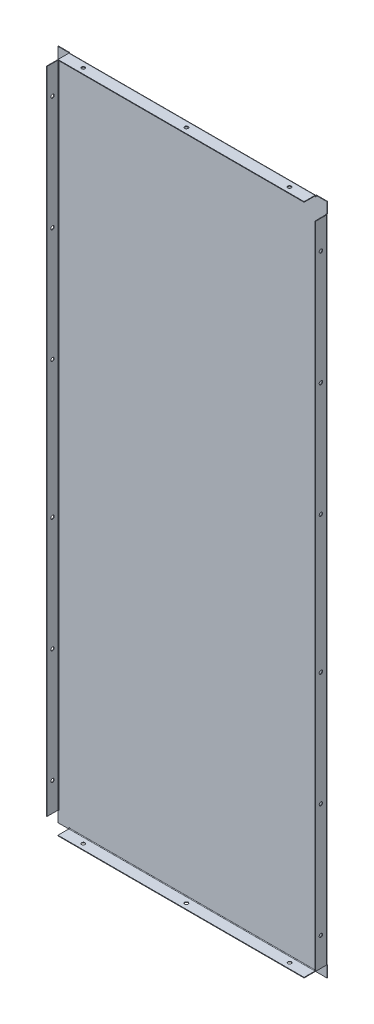
from build123d import *

# Parameters (mm, degrees)
SKETCH1_W                     = 472
SKETCH1_H                     = 1
BASE_FLANGE1_DEPTH            = 590
EDGE_FLANGE1_STRIP_W          = 6
EDGE_FLANGE1_STRIP_H          = 1
EDGE_FLANGE1_STRIP_CUT_DEPTH  = 432
EDGE_FLANGE1_RELIEF_W         = 6.5
EDGE_FLANGE1_RELIEF_H         = 0.5
EDGE_FLANGE1_RELIEF_CUT_DEPTH = 1
EDGE_FLANGE1_DEPTH            = 432
EDGE_FLANGE2_STRIP_W          = 6
EDGE_FLANGE2_STRIP_H          = 1
EDGE_FLANGE2_STRIP_CUT_DEPTH  = 1140
EDGE_FLANGE2_RELIEF_W         = 6.5
EDGE_FLANGE2_RELIEF_H         = 0.5
EDGE_FLANGE2_RELIEF_CUT_DEPTH = 1
EDGE_FLANGE2_DEPTH            = 1140
SKETCH16_R                    = 3
CUT_EXTRUDE1_DEPTH            = 756.860436853
SKETCH18_R                    = 3
CUT_EXTRUDE2_DEPTH            = 1204.551826886


# Sheet-metal steps are written as plain solids
with BuildPart() as part:
    # Sketch1 → Base-Flange1 (new, symmetric)
    with BuildSketch(Plane(origin=(0, 0, 0), x_dir=(1, 0, 0), z_dir=(0, 1, 0))):
        with Locations((0, -0.5)):
            Rectangle(SKETCH1_W, SKETCH1_H)
    extrude(amount=BASE_FLANGE1_DEPTH, both=True)

    # Edge-Flange1 strip (across the edge) → Edge-Flange1 strip cut (cut)
    with BuildSketch(Plane(origin=(-216, -590, 1), x_dir=(0, 1, 0), z_dir=(1, 0, 0))):
        with Locations((-1, -0.5)):
            Rectangle(EDGE_FLANGE1_STRIP_W, EDGE_FLANGE1_STRIP_H)
    edge_flange1_strip_cut = extrude(amount=EDGE_FLANGE1_STRIP_CUT_DEPTH, mode=Mode.SUBTRACT)

    # Edge-Flange1 relief (on the sheet) → Edge-Flange1 relief cut (cut)
    with BuildSketch(Plane(origin=(-216, -588, 1), x_dir=(0, 1, 0), z_dir=(0, 0, 1))):
        with Locations((-2.75, 0.25)):
            Rectangle(EDGE_FLANGE1_RELIEF_W, EDGE_FLANGE1_RELIEF_H)
        with Locations((-2.75, -432.25)):
            Rectangle(EDGE_FLANGE1_RELIEF_W, EDGE_FLANGE1_RELIEF_H)
    edge_flange1_relief_cut = extrude(amount=-EDGE_FLANGE1_RELIEF_CUT_DEPTH, mode=Mode.SUBTRACT)

    # Edge-Flange1 section (across the edge) → Edge-Flange1 (add)
    with BuildSketch(Plane(origin=(-216, -590, 1), x_dir=(0, 1, 0), z_dir=(1, 0, 0))):
        with BuildLine():
            Line((0, 1), (0, 20))
            Line((0, 20), (1, 20))
            Line((1, 20), (1, 1))
            ThreePointArc((1, 1), (1.292893219, 0.292893219), (2, 0))
            Line((2, 0), (2, -1))
            ThreePointArc((2, -1), (0.585786438, -0.414213562), (0, 1))
        make_face()
    edge_flange1 = extrude(amount=EDGE_FLANGE1_DEPTH)

    # Mirror1: Edge-Flange1 strip cut, Edge-Flange1 relief cut, Edge-Flange1 across plane
    add(edge_flange1_strip_cut.mirror(Plane.ZX), mode=Mode.SUBTRACT)
    add(edge_flange1_relief_cut.mirror(Plane.ZX), mode=Mode.SUBTRACT)
    add(edge_flange1.mirror(Plane.ZX))

    # Edge-Flange2 strip (across the edge) → Edge-Flange2 strip cut (cut)
    with BuildSketch(Plane(origin=(-236, 570, 1), x_dir=(1, 0, 0), z_dir=(0, -1, 0))):
        with Locations((-1, -0.5)):
            Rectangle(EDGE_FLANGE2_STRIP_W, EDGE_FLANGE2_STRIP_H)
    edge_flange2_strip_cut = extrude(amount=EDGE_FLANGE2_STRIP_CUT_DEPTH, mode=Mode.SUBTRACT)

    # Edge-Flange2 relief (on the sheet) → Edge-Flange2 relief cut (cut)
    with BuildSketch(Plane(origin=(-234, 570, 1), x_dir=(1, 0, 0), z_dir=(0, 0, 1))):
        with Locations((-2.75, 0.25)):
            Rectangle(EDGE_FLANGE2_RELIEF_W, EDGE_FLANGE2_RELIEF_H)
        with Locations((-2.75, -1140.25)):
            Rectangle(EDGE_FLANGE2_RELIEF_W, EDGE_FLANGE2_RELIEF_H)
    edge_flange2_relief_cut = extrude(amount=-EDGE_FLANGE2_RELIEF_CUT_DEPTH, mode=Mode.SUBTRACT)

    # Edge-Flange2 section (across the edge) → Edge-Flange2 (add)
    with BuildSketch(Plane(origin=(-236, 570, 1), x_dir=(1, 0, 0), z_dir=(0, -1, 0))):
        with BuildLine():
            Line((0, 1), (0, 20))
            Line((0, 20), (1, 20))
            Line((1, 20), (1, 1))
            ThreePointArc((1, 1), (1.292893219, 0.292893219), (2, 0))
            Line((2, 0), (2, -1))
            ThreePointArc((2, -1), (0.585786438, -0.414213562), (0, 1))
        make_face()
    edge_flange2 = extrude(amount=EDGE_FLANGE2_DEPTH)

    # Mirror2: Edge-Flange2 strip cut, Edge-Flange2 relief cut, Edge-Flange2 across plane
    add(edge_flange2_strip_cut.mirror(Plane(origin=(0, 0, 0), x_dir=(0, 0, 1), z_dir=(1, 0, 0))), mode=Mode.SUBTRACT)
    add(edge_flange2_relief_cut.mirror(Plane(origin=(0, 0, 0), x_dir=(0, 0, 1), z_dir=(1, 0, 0))), mode=Mode.SUBTRACT)
    add(edge_flange2.mirror(Plane(origin=(0, 0, 0), x_dir=(0, 0, 1), z_dir=(1, 0, 0))))

    # Sketch16 → Cut-Extrude1 (cut, through all)
    with BuildSketch(Plane.ZY.offset(236)):
        with Locations((11.5, 520)):
            Circle(SKETCH16_R)
        with Locations((11.5, 320)):
            Circle(SKETCH16_R)
        with Locations((11.5, 120)):
            Circle(SKETCH16_R)
        with Locations(Location((11.5, -120, 0), (0, 0, 180))):
            Circle(SKETCH16_R)
        with Locations(Location((11.5, -320, 0), (0, 0, 180))):
            Circle(SKETCH16_R)
        with Locations(Location((11.5, -520, 0), (0, 0, 180))):
            Circle(SKETCH16_R)
    extrude(amount=-CUT_EXTRUDE1_DEPTH, mode=Mode.SUBTRACT)

    # Sketch18 → Cut-Extrude2 (cut, through all)
    with BuildSketch(Plane(origin=(0, 590, 0), x_dir=(1, 0, 0), z_dir=(0, 1, 0))):
        with Locations(Location((-181, -11.5, 0), (0, 0, 270))):
            Circle(SKETCH18_R)
        with Locations(Location((0, -11.5, 0), (0, 0, 270))):
            Circle(SKETCH18_R)
        with Locations(Location((181, -11.5, 0), (0, 0, 90))):
            Circle(SKETCH18_R)
    extrude(amount=-CUT_EXTRUDE2_DEPTH, mode=Mode.SUBTRACT)


solid = part.part
